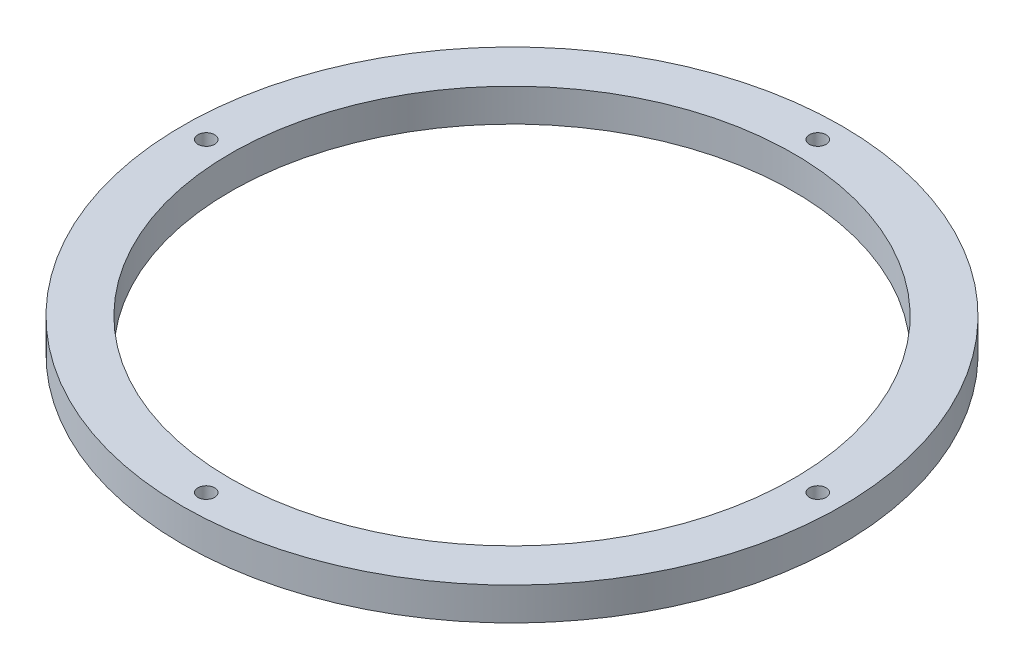
from build123d import *

# Parameters (mm, degrees)
SKETCH1_R                                          = 100.375000037
SKETCH1_R_2                                        = 85.74999995
BOSS_EXTRUDE1_DEPTH                                = 5.000000033
SKETCH2_R                                          = 1.27
CUT_EXTRUDE1_DEPTH                                 = 143.03971721
CIRPATTERN1_COUNT                                  = 4
CSK_FOR_10_FLAT_HEAD_MACHINE_SCREW_100_D           = 5.1054
CSK_FOR_10_FLAT_HEAD_MACHINE_SCREW_100_CSINK_D     = 9.779
CSK_FOR_10_FLAT_HEAD_MACHINE_SCREW_100_CSINK_ANGLE = 100


with BuildPart() as part:
    # Sketch1 → Boss-Extrude1 (new, symmetric)
    with BuildSketch(Plane(origin=(0, 0, 0), x_dir=(1, 0, 0), z_dir=(0, 1, 0))):
        Circle(SKETCH1_R)
        Circle(SKETCH1_R_2, mode=Mode.SUBTRACT)
    extrude(amount=BOSS_EXTRUDE1_DEPTH, both=True)

    # Sketch2 → Cut-Extrude1 (cut, symmetric)
    with BuildSketch(Plane(origin=(0, 0, 0), x_dir=(1, 0, 0), z_dir=(0, 1, 0))):
        with Locations((-93.125000059, 0)):
            Circle(SKETCH2_R)
    cut_extrude1 = extrude(amount=CUT_EXTRUDE1_DEPTH, both=True, mode=Mode.SUBTRACT)

    # CirPattern1: Cut-Extrude1 ×4 about axis
    cirpattern1_axis = Axis((0, 5.500000036, 0), (0, -1, 0))
    for i in range(1, CIRPATTERN1_COUNT):
        add(cut_extrude1.rotate(cirpattern1_axis, i * 360 / CIRPATTERN1_COUNT), mode=Mode.SUBTRACT)

    # CSK for #10 Flat Head Machine Screw (100)1 (through all)
    with Locations(Plane(origin=(93.125000059, -5.000000033, 0), x_dir=(0, 0, -1), z_dir=(0, -1, 0))):
        with Locations((0, 0), (93.125000059, -93.125000059), (0, -186.250000118), (-93.125000059, -93.125000059)):
            CounterSinkHole(CSK_FOR_10_FLAT_HEAD_MACHINE_SCREW_100_D / 2, CSK_FOR_10_FLAT_HEAD_MACHINE_SCREW_100_CSINK_D / 2, counter_sink_angle=CSK_FOR_10_FLAT_HEAD_MACHINE_SCREW_100_CSINK_ANGLE)


solid = part.part
